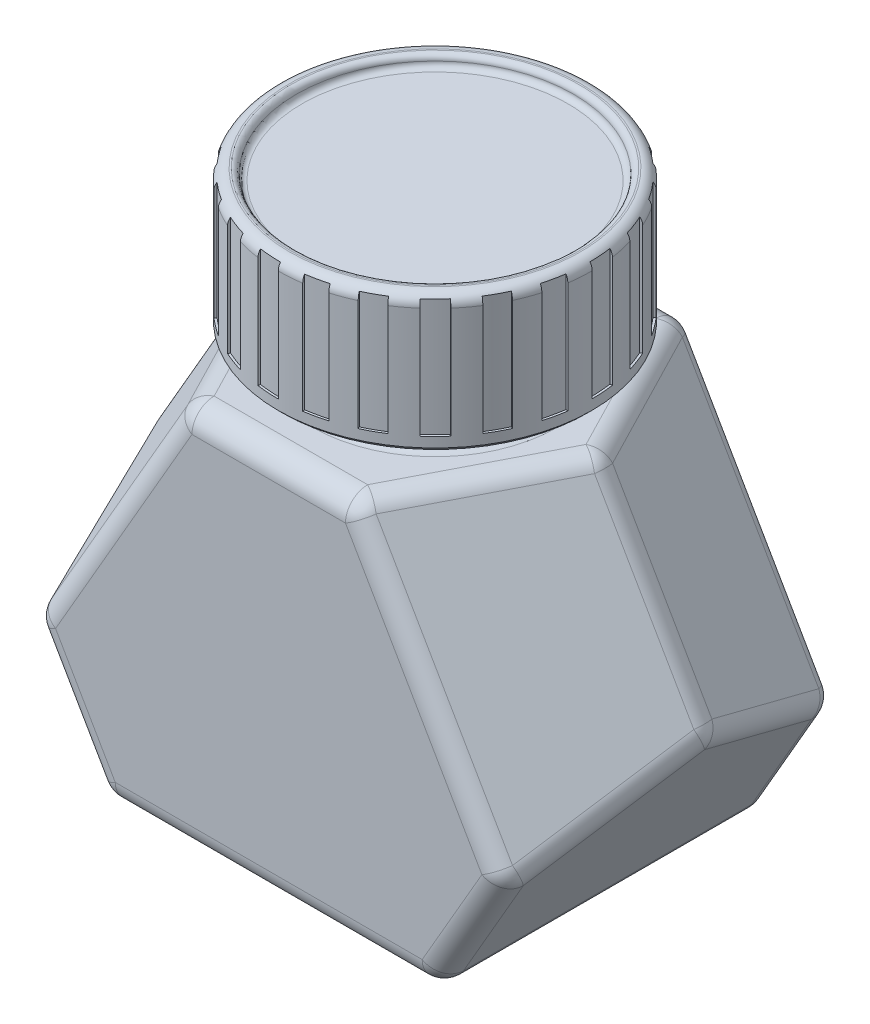
from build123d import *

# Parameters (mm, degrees)
BOSS_EXTRUDE1_DEPTH = 38.1
CUT_EXTRUDE1_DEPTH  = 93.239077944
SKETCH6_R           = 12.7
BOSS_EXTRUDE2_DEPTH = 3.175
FILLET1_R           = 2.54
FILLET2_R           = 1.27
SKETCH7_R           = 17.9578
BOSS_EXTRUDE3_DEPTH = 15.621
CUT_EXTRUDE2_START  = -13.97
CUT_EXTRUDE2_DEPTH  = 13.97
SKETCH9_R           = 15.875
CUT_EXTRUDE3_DEPTH  = 1.27
FILLET4_R           = 0.635
CHAMFER1_SIZE       = 0.508


with BuildPart() as part:
    # Sketch2 → Boss-Extrude1 (new body)
    with BuildSketch(Plane.XY):
        Polygon((50.8, 0), (12.7, 0), (0, 21.997045256), (12.7, 43.994090512), (50.8, 43.994090512), (63.5, 21.997045256), align=None)
    extrude(amount=BOSS_EXTRUDE1_DEPTH)

    # Sketch5 → Cut-Extrude1 (cut, through all)
    with BuildSketch(Plane(origin=(-15.875, 27.49630657, 0), x_dir=(0.8660254037844417, 0.49999999999999484, 0), z_dir=(-0.49999999999999484, 0.8660254037844417, 0))):
        Polygon((57.486744525, 0), (65.991135768, -19.05), (57.486744525, -38.1), (69.753239187, -41.697429968), (70.294063597, 8.676500848), align=None)
    cut_extrude1 = extrude(amount=-CUT_EXTRUDE1_DEPTH, mode=Mode.SUBTRACT)

    # Mirror1: Cut-Extrude1 across plane
    add(cut_extrude1.mirror(Plane(origin=(31.75, 0, 0), x_dir=(0, 0, 1), z_dir=(1, 0, 0))), mode=Mode.SUBTRACT)

    # Sketch6 → Boss-Extrude2 (add)
    with BuildSketch(Plane(origin=(0, 43.994090512, 0), x_dir=(1, 0, 0), z_dir=(0, 1, 0))):
        with Locations(Location((31.75, -19.05, 0), (0, 0, 90))):
            Circle(SKETCH6_R)
    extrude(amount=BOSS_EXTRUDE2_DEPTH)

    # Fillet1
    fillet1_edges = [part.edges().sort_by_distance(p)[0] for p in [
        (54.694993713, 6.746327006, 38.1),
        (50.8, 0, 19.05),
        (12.7, 0, 19.05),
        (31.75, 43.994090512, 0),
        (49.78498114, 28.743372263, 0),
        (31.75, 43.994090512, 38.1),
        (49.78498114, 28.743372263, 38.1),
        (61.044993713, 17.744849635, 28.575),
        (45.889987426, 43.994090512, 28.575),
        (61.044993713, 17.744849635, 9.525),
        (57.15, 32.995567884, 19.05),
        (45.889987426, 43.994090512, 9.525),
        (8.805006287, 6.746327006, 0),
        (13.71501886, 28.743372263, 0),
        (8.805006287, 6.746327006, 38.1),
        (13.71501886, 28.743372263, 38.1),
        (6.35, 32.995567884, 19.05),
        (2.455006287, 17.744849635, 28.575),
        (2.455006287, 17.744849635, 9.525),
        (17.610012574, 43.994090512, 9.525),
        (17.610012574, 43.994090512, 28.575),
        (31.75, 0, 38.1),
        (54.694993713, 6.746327006, 0),
        (31.75, 0, 0),
    ]]
    fillet(fillet1_edges, radius=FILLET1_R)

    # Fillet2
    fillet2_edges = [part.edges().sort_by_distance(p)[0] for p in [
        (31.75, 43.994090512, 31.75),
    ]]
    fillet(fillet2_edges, radius=FILLET2_R)

    # Sketch7 → Boss-Extrude3 (add)
    with BuildSketch(Plane(origin=(0, 47.169090512, 0), x_dir=(1, 0, 0), z_dir=(0, 1, 0))):
        with Locations(Location((31.75, -19.05, 0), (0, 0, 90))):
            Circle(SKETCH7_R)
    extrude(amount=BOSS_EXTRUDE3_DEPTH)

    # Sketch8 → Cut-Extrude2 (cut)
    with BuildSketch(Plane(origin=(0, 62.790090512, 0), x_dir=(1, 0, 0), z_dir=(0, 1, 0)).offset(CUT_EXTRUDE2_START)):
        with BuildLine():
            Line((31.75, -1.0922), (31.75, -1.3462))
            ThreePointArc((31.75, -1.3462), (32.98495466, -1.389325567), (34.213892745, -1.518492165))
            Line((34.213892745, -1.518492165), (34.249242712, -1.266964075))
            ThreePointArc((34.249242712, -1.266964075), (33.002672804, -1.135944298), (31.75, -1.0922))
        make_face()
        with BuildLine():
            Line((36.809296909, -1.819617078), (36.73773684, -2.063328294))
            ThreePointArc((36.73773684, -2.063328294), (37.910517282, -2.452633906), (39.053284304, -2.922800218))
            Line((39.053284304, -2.922800218), (39.158066001, -2.69142002))
            ThreePointArc((39.158066001, -2.69142002), (37.99890347, -2.214508137), (36.809296909, -1.819617078))
        make_face()
        with BuildLine():
            Line((41.458719672, -3.942937308), (41.321396904, -4.156615705))
            ThreePointArc((41.321396904, -4.156615705), (42.336991433, -4.860562138), (43.301007203, -5.633638085))
            Line((43.301007203, -5.633638085), (43.46673184, -5.441150827))
            ThreePointArc((43.46673184, -5.441150827), (42.488885141, -4.656983402), (41.458719672, -3.942937308))
        make_face()
        with BuildLine():
            Line((45.321599706, -7.290141912), (45.129639314, -7.456476538))
            ThreePointArc((45.129639314, -7.456476538), (45.9057705, -8.418034237), (46.612936196, -9.431389805))
            Line((46.612936196, -9.431389805), (46.826177748, -9.293389659))
            ThreePointArc((46.826177748, -9.293389659), (46.108866204, -8.265495274), (45.321599706, -7.290141912))
        make_face()
        with BuildLine():
            Line((48.084989446, -11.59006028), (47.853942919, -11.695575693))
            ThreePointArc((47.853942919, -11.695575693), (48.32773323, -12.836844972), (48.72075849, -14.008384118))
            Line((48.72075849, -14.008384118), (48.964241396, -13.936051035))
            ThreePointArc((48.964241396, -13.936051035), (48.565577322, -12.74770358), (48.084989446, -11.59006028))
        make_face()
        with BuildLine():
            Line((49.525015489, -16.494338597), (49.273600843, -16.530486566))
            ThreePointArc((49.273600843, -16.530486566), (49.406666605, -17.759008576), (49.453710861, -18.993820167))
            Line((49.453710861, -18.993820167), (49.707709583, -18.993014144))
            ThreePointArc((49.707709583, -18.993014144), (49.659990372, -17.740486461), (49.525015489, -16.494338597))
        make_face()
        with BuildLine():
            Line((49.525015489, -21.605661403), (49.273600843, -21.569513434))
            ThreePointArc((49.273600843, -21.569513434), (49.055161859, -22.785760628), (48.752413866, -23.983807572))
            Line((48.752413866, -23.983807572), (48.996350938, -24.054593907))
            ThreePointArc((48.996350938, -24.054593907), (49.303442517, -22.839358341), (49.525015489, -21.605661403))
        make_face()
        with BuildLine():
            Line((48.084989446, -26.50993972), (47.853942919, -26.404424307))
            ThreePointArc((47.853942919, -26.404424307), (47.301695818, -27.509863571), (46.673682417, -28.574087229))
            Line((46.673682417, -28.574087229), (46.887795508, -28.710731235))
            ThreePointArc((46.887795508, -28.710731235), (47.524819144, -27.631238945), (48.084989446, -26.50993972))
        make_face()
        with BuildLine():
            Line((45.321599706, -30.809858088), (45.129639314, -30.643523462))
            ThreePointArc((45.129639314, -30.643523462), (44.288323871, -31.54859868), (43.385922973, -32.392781981))
            Line((43.385922973, -32.392781981), (43.552865914, -32.584213574))
            ThreePointArc((43.552865914, -32.584213574), (44.46821374, -31.727918603), (45.321599706, -30.809858088))
        make_face()
        with BuildLine():
            Line((41.458719672, -34.157062692), (41.321396904, -33.943384295))
            ThreePointArc((41.321396904, -33.943384295), (40.259171492, -34.574771656), (39.155490251, -35.13052389))
            Line((39.155490251, -35.13052389), (39.261738318, -35.361234419))
            ThreePointArc((39.261738318, -35.361234419), (40.381254297, -34.797508695), (41.458719672, -34.157062692))
        make_face()
        with BuildLine():
            Line((36.809296909, -36.280382922), (36.73773684, -36.036671706))
            ThreePointArc((36.73773684, -36.036671706), (35.540656645, -36.343219962), (34.325108751, -36.565517388))
            Line((34.325108751, -36.565517388), (34.362054358, -36.816816059))
            ThreePointArc((34.362054358, -36.816816059), (35.595041962, -36.591329287), (36.809296909, -36.280382922))
        make_face()
        with BuildLine():
            Line((31.75, -37.0078), (31.75, -36.7538))
            ThreePointArc((31.75, -36.7538), (30.51504534, -36.710674433), (29.286107255, -36.581507835))
            Line((29.286107255, -36.581507835), (29.250757288, -36.833035925))
            ThreePointArc((29.250757288, -36.833035925), (30.497327196, -36.964055702), (31.75, -37.0078))
        make_face()
        with BuildLine():
            Line((26.690703091, -36.280382922), (26.76226316, -36.036671706))
            ThreePointArc((26.76226316, -36.036671706), (25.589482718, -35.647366094), (24.446715696, -35.177199782))
            Line((24.446715696, -35.177199782), (24.341933999, -35.40857998))
            ThreePointArc((24.341933999, -35.40857998), (25.50109653, -35.885491863), (26.690703091, -36.280382922))
        make_face()
        with BuildLine():
            Line((22.041280328, -34.157062692), (22.178603096, -33.943384295))
            ThreePointArc((22.178603096, -33.943384295), (21.163008567, -33.239437862), (20.198992797, -32.466361915))
            Line((20.198992797, -32.466361915), (20.03326816, -32.658849173))
            ThreePointArc((20.03326816, -32.658849173), (21.011114859, -33.443016598), (22.041280328, -34.157062692))
        make_face()
        with BuildLine():
            Line((18.178400294, -30.809858088), (18.370360686, -30.643523462))
            ThreePointArc((18.370360686, -30.643523462), (17.5942295, -29.681965763), (16.887063804, -28.668610195))
            Line((16.887063804, -28.668610195), (16.673822252, -28.806610341))
            ThreePointArc((16.673822252, -28.806610341), (17.391133796, -29.834504726), (18.178400294, -30.809858088))
        make_face()
        with BuildLine():
            Line((15.415010554, -26.50993972), (15.646057081, -26.404424307))
            ThreePointArc((15.646057081, -26.404424307), (15.17226677, -25.263155028), (14.77924151, -24.091615882))
            Line((14.77924151, -24.091615882), (14.535758604, -24.163948965))
            ThreePointArc((14.535758604, -24.163948965), (14.934422678, -25.35229642), (15.415010554, -26.50993972))
        make_face()
        with BuildLine():
            Line((13.974984511, -21.605661403), (14.226399157, -21.569513434))
            ThreePointArc((14.226399157, -21.569513434), (14.093333395, -20.340991424), (14.046289139, -19.106179833))
            Line((14.046289139, -19.106179833), (13.792290417, -19.106985856))
            ThreePointArc((13.792290417, -19.106985856), (13.840009628, -20.359513539), (13.974984511, -21.605661403))
        make_face()
        with BuildLine():
            Line((13.974984511, -16.494338597), (14.226399157, -16.530486566))
            ThreePointArc((14.226399157, -16.530486566), (14.444838141, -15.314239372), (14.747586134, -14.116192428))
            Line((14.747586134, -14.116192428), (14.503649062, -14.045406093))
            ThreePointArc((14.503649062, -14.045406093), (14.196557483, -15.260641659), (13.974984511, -16.494338597))
        make_face()
        with BuildLine():
            Line((15.415010554, -11.59006028), (15.646057081, -11.695575693))
            ThreePointArc((15.646057081, -11.695575693), (16.198304182, -10.590136429), (16.826317583, -9.525912771))
            Line((16.826317583, -9.525912771), (16.612204492, -9.389268765))
            ThreePointArc((16.612204492, -9.389268765), (15.975180856, -10.468761055), (15.415010554, -11.59006028))
        make_face()
        with BuildLine():
            Line((18.178400294, -7.290141912), (18.370360686, -7.456476538))
            ThreePointArc((18.370360686, -7.456476538), (19.211676129, -6.55140132), (20.114077027, -5.707218019))
            Line((20.114077027, -5.707218019), (19.947134086, -5.515786426))
            ThreePointArc((19.947134086, -5.515786426), (19.03178626, -6.372081397), (18.178400294, -7.290141912))
        make_face()
        with BuildLine():
            Line((22.041280328, -3.942937308), (22.178603096, -4.156615705))
            ThreePointArc((22.178603096, -4.156615705), (23.240828508, -3.525228344), (24.344509749, -2.96947611))
            Line((24.344509749, -2.96947611), (24.238261682, -2.738765581))
            ThreePointArc((24.238261682, -2.738765581), (23.118745703, -3.302491305), (22.041280328, -3.942937308))
        make_face()
        with BuildLine():
            Line((26.690703091, -1.819617078), (26.76226316, -2.063328294))
            ThreePointArc((26.76226316, -2.063328294), (27.959343355, -1.756780038), (29.174891249, -1.534482612))
            Line((29.174891249, -1.534482612), (29.137945642, -1.283183941))
            ThreePointArc((29.137945642, -1.283183941), (27.904958038, -1.508670713), (26.690703091, -1.819617078))
        make_face()
    extrude(amount=CUT_EXTRUDE2_DEPTH, mode=Mode.SUBTRACT)

    # Sketch9 → Cut-Extrude3 (cut)
    with BuildSketch(Plane(origin=(0, 62.790090512, 0), x_dir=(1, 0, 0), z_dir=(0, 1, 0))):
        with Locations(Location((31.75, -19.05, 0), (0, 0, 270))):
            Circle(SKETCH9_R)
    extrude(amount=-CUT_EXTRUDE3_DEPTH, mode=Mode.SUBTRACT)

    # Fillet4
    fillet4_edges = [part.edges().sort_by_distance(p)[0] for p in [
        (31.75, 61.520090512, 3.175),
        (31.75, 62.790090512, 3.175),
    ]]
    fillet(fillet4_edges, radius=FILLET4_R - 0.0001)  # a hair under: the kernel refuses the full size

    # Sketch10 → Cut-Revolve2 (revolve, cut)
    with BuildSketch(Plane(origin=(31.75, 0, 0), x_dir=(0, 0, -1), z_dir=(1, 0, 0)), mode=Mode.PRIVATE) as cut_revolve2_sk:
        with BuildLine():
            Line((-2.3622, 62.790090512), (-2.3622, 63.794927188))
            Line((-2.3622, 63.794927188), (-1.0922, 65.961379662))
            Line((-1.0922, 65.961379662), (2.766937121, 64.463794702))
            Line((2.766937121, 64.463794702), (1.315380156, 61.772250483))
            Line((1.315380156, 61.772250483), (-1.0922, 61.520090512))
            ThreePointArc((-1.0922, 61.520090512), (-1.464174388, 62.418116124), (-2.3622, 62.790090512))
        make_face()
    revolve(cut_revolve2_sk.sketch.rotate(Axis((31.75, 0, 19.05), (0, -1, 0)), 180), axis=Axis((31.75, 0, 19.05), (0, -1, 0)), mode=Mode.SUBTRACT)

    # Chamfer1
    chamfer1_edges = [part.edges().sort_by_distance(p)[0] for p in [
        (31.75, 47.169090512, 37.0078),
    ]]
    chamfer(chamfer1_edges, length=CHAMFER1_SIZE)


solid = part.part
